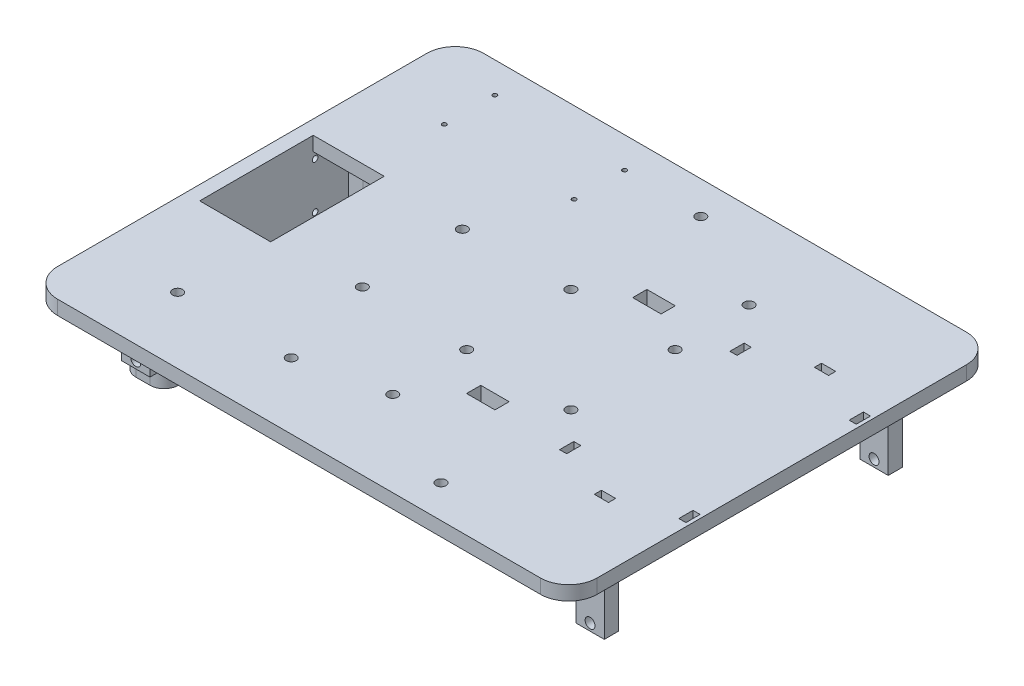
from build123d import *

# Parameters (mm, degrees)
BOSS_EXTRUDE1_DEPTH = 5
SKETCH2_R           = 1.75
SKETCH2_R_2         = 0.75
SKETCH2_W           = 10
SKETCH2_H           = 5
SKETCH2_W_2         = 2.5
SKETCH2_W_3         = 25
SKETCH2_H_2         = 40
SKETCH2_W_4         = 5
SKETCH2_H_3         = 2.5
CUT_EXTRUDE1_DEPTH  = 122.140414396
SKETCH6_W           = 10
SKETCH6_H           = 5
BOSS_EXTRUDE3_DEPTH = 25
SKETCH7_R           = 1.75
CUT_EXTRUDE3_DEPTH  = 158.023087474
FILLET1_R           = 2.5
MIRROR2_START       = -55
MIRROR2_OUTLINE_R   = 1.75
MIRROR2_DEPTH       = 10
MIRROR2_START_2     = 45
MIRROR2_2_OUTLINE_R = 1.75
MIRROR2_2_DEPTH     = 10
MIRROR2_START_3     = -87.5
MIRROR2_3_DEPTH     = 175.5
SKETCH8_W           = 10
SKETCH8_H           = 10
BOSS_EXTRUDE4_DEPTH = 37.5
SKETCH9_W           = 85
SKETCH9_H           = 37.5
BOSS_EXTRUDE8_DEPTH = 5
SKETCH10_R          = 1.75
SKETCH10_R_2        = 1
CUT_EXTRUDE4_DEPTH  = 204.116345969
FILLET2_R           = 5


with BuildPart() as part:
    # Sketch1 → Boss-Extrude1 (new body)
    with BuildSketch(Plane(origin=(0, 0, 0), x_dir=(1, 0, 0), z_dir=(0, 1, 0))):
        with BuildLine():
            Line((-85, -75), (85, -75))
            ThreePointArc((85, -75), (92.071067812, -72.071067812), (95, -65))
            Line((95, -65), (95, 65))
            ThreePointArc((95, 65), (92.071067812, 72.071067812), (85, 75))
            Line((85, 75), (-85, 75))
            ThreePointArc((-85, 75), (-92.071067812, 72.071067812), (-95, 65))
            Line((-95, 65), (-95, -65))
            ThreePointArc((-95, -65), (-92.071067812, -72.071067812), (-85, -75))
        make_face()
    extrude(amount=BOSS_EXTRUDE1_DEPTH)

    # Sketch2 → Cut-Extrude1 (cut, through all)
    with BuildSketch(Plane(origin=(0, 5, 0), x_dir=(1, 0, 0), z_dir=(0, 1, 0))):
        with Locations(Location((-66, -51.75, 0), (0, 0, 270))):
            Circle(SKETCH2_R)
        with Locations(Location((-26, -51.75, 0), (0, 0, 270))):
            Circle(SKETCH2_R)
        with Locations(Location((-35.1, 17.6, 0), (0, 0, 270))):
            Circle(SKETCH2_R)
        with Locations(Location((-35.1, -17.6, 0), (0, 0, 270))):
            Circle(SKETCH2_R)
        with Locations(Location((2.400579028, 18.349420972, 0), (0, 0, 270))):
            Circle(SKETCH2_R)
        with Locations(Location((39.099420972, 18.349420972, 0), (0, 0, 270))):
            Circle(SKETCH2_R)
        with Locations(Location((39.099420972, -18.349420972, 0), (0, 0, 270))):
            Circle(SKETCH2_R)
        with Locations(Location((2.400579028, -18.349420972, 0), (0, 0, 270))):
            Circle(SKETCH2_R)
        with Locations(Location((3.011718317, -45.011311623, 0), (0, 0, 270))):
            Circle(SKETCH2_R)
        with Locations(Location((38.488281683, -63.488688377, 0), (0, 0, 270))):
            Circle(SKETCH2_R)
        with Locations(Location((38.488281683, 45.011311623, 0), (0, 0, 270))):
            Circle(SKETCH2_R)
        with Locations(Location((3.011718317, 63.488688377, 0), (0, 0, 270))):
            Circle(SKETCH2_R)
        with Locations(Location((-70.26, 64.19, 0), (0, 0, 270))):
            Circle(SKETCH2_R_2)
        with Locations(Location((-70.26, 46.41, 0), (0, 0, 270))):
            Circle(SKETCH2_R_2)
        with Locations(Location((-24.54, 64.19, 0), (0, 0, 270))):
            Circle(SKETCH2_R_2)
        with Locations(Location((-24.54, 46.41, 0), (0, 0, 270))):
            Circle(SKETCH2_R_2)
        with Locations((20.75, -29.25)):
            Rectangle(SKETCH2_W, SKETCH2_H)
        with Locations((50.5, 30)):
            Rectangle(SKETCH2_W_2, SKETCH2_H)
        with Locations((50.5, -30)):
            Rectangle(SKETCH2_W_2, SKETCH2_H)
        with Locations((92.5, -30)):
            Rectangle(SKETCH2_W_2, SKETCH2_H)
        with Locations((92.5, 30)):
            Rectangle(SKETCH2_W_2, SKETCH2_H)
        with Locations((-77.5, 0)):
            Rectangle(SKETCH2_W_3, SKETCH2_H_2)
        with Locations((20.75, 29.25)):
            Rectangle(SKETCH2_W, SKETCH2_H)
        with Locations((71.5, -38.75)):
            Rectangle(SKETCH2_W_4, SKETCH2_H_3)
        with Locations((71.5, 38.75)):
            Rectangle(SKETCH2_W_4, SKETCH2_H_3)
    extrude(amount=-CUT_EXTRUDE1_DEPTH, mode=Mode.SUBTRACT)

    # Sketch6 → Boss-Extrude3 (add)
    with BuildSketch(Plane.XZ):
        with Locations((-80, 50)):
            Rectangle(SKETCH6_W, SKETCH6_H)
    extrude(amount=BOSS_EXTRUDE3_DEPTH)

    # Sketch7 → Cut-Extrude3 (cut, through all)
    with BuildSketch(Plane(origin=(0, 0, 47.5), x_dir=(-1, 0, 0), z_dir=(0, 0, -1))):
        with Locations((80, -22.5)):
            Circle(SKETCH7_R)
        with Locations((80, -5)):
            Circle(SKETCH7_R)
    extrude(amount=-CUT_EXTRUDE3_DEPTH, mode=Mode.SUBTRACT)

    # Fillet1
    fillet1_edges = [part.edges().sort_by_distance(p)[0] for p in [
        (-75, 0, 50),
        (-80, 0, 52.5),
        (-85, 0, 50),
        (-80, 0, 47.5),
    ]]
    fillet(fillet1_edges, radius=FILLET1_R)

    # Mirror2: read off the stored shape, not the designer's step
    # Mirror2 outline → Mirror2 (add)
    # profile 1 of 2: a face of its own
    with BuildSketch(Plane.XY.offset(MIRROR2_START)):
        with BuildLine():
            Line((87.5, 0), (72.5, 0))
            ThreePointArc((72.5, 0), (74.267766953, -0.732233047), (75, -2.5))
            Line((75, -2.5), (75, -25))
            Line((75, -25), (85, -25))
            Line((85, -25), (85, -2.5))
            ThreePointArc((85, -2.5), (85.732233047, -0.732233047), (87.5, 0))
        make_face()
        with Locations((80, -22.5)):
            Circle(MIRROR2_OUTLINE_R, mode=Mode.SUBTRACT)
        with Locations((80, -5)):
            Circle(MIRROR2_OUTLINE_R, mode=Mode.SUBTRACT)
    # profile 2 of 2: a face of its own
    with BuildSketch(Plane.XY.offset(MIRROR2_START)):
        with BuildLine():
            Line((-75, -25), (-75, -2.5))
            ThreePointArc((-75, -2.5), (-74.267766953, -0.732233047), (-72.5, 0))
            Line((-72.5, 0), (-87.5, 0))
            ThreePointArc((-87.5, 0), (-85.732233047, -0.732233047), (-85, -2.5))
            Line((-85, -2.5), (-85, -25))
            Line((-85, -25), (-75, -25))
        make_face()
        with Locations((-80, -22.5)):
            Circle(MIRROR2_OUTLINE_R, mode=Mode.SUBTRACT)
        with Locations((-80, -5)):
            Circle(MIRROR2_OUTLINE_R, mode=Mode.SUBTRACT)
    extrude(amount=MIRROR2_DEPTH)

    # Mirror2 2 outline → Mirror2 2 (add)
    with BuildSketch(Plane.XY.offset(MIRROR2_START_2)):
        with BuildLine():
            Line((87.5, 0), (72.5, 0))
            ThreePointArc((72.5, 0), (74.267766953, -0.732233047), (75, -2.5))
            Line((75, -2.5), (75, -25))
            Line((75, -25), (85, -25))
            Line((85, -25), (85, -2.5))
            ThreePointArc((85, -2.5), (85.732233047, -0.732233047), (87.5, 0))
        make_face()
        with Locations((80, -22.5)):
            Circle(MIRROR2_2_OUTLINE_R, mode=Mode.SUBTRACT)
        with Locations((80, -5)):
            Circle(MIRROR2_2_OUTLINE_R, mode=Mode.SUBTRACT)
    extrude(amount=MIRROR2_2_DEPTH)

    # Mirror2 3 outline → Mirror2 3 (cut)
    with BuildSketch(Plane.YZ.offset(MIRROR2_START_3)):
        with BuildLine():
            Line((-25, 55), (-25, 52.5))
            Line((-25, 52.5), (-2.5, 52.5))
            ThreePointArc((-2.5, 52.5), (-0.732233047, 53.232233047), (0, 55))
            Line((0, 55), (-25, 55))
        make_face()
        with BuildLine():
            Line((-2.5, 47.5), (-25, 47.5))
            Line((-25, 47.5), (-25, 45))
            Line((-25, 45), (0, 45))
            ThreePointArc((0, 45), (-0.732233047, 46.767766953), (-2.5, 47.5))
        make_face()
        with BuildLine():
            Line((-25, -47.5), (-2.5, -47.5))
            ThreePointArc((-2.5, -47.5), (-0.732233047, -46.767766953), (0, -45))
            Line((0, -45), (-25, -45))
            Line((-25, -45), (-25, -47.5))
        make_face()
        with BuildLine():
            Line((-2.5, -52.5), (-25, -52.5))
            Line((-25, -52.5), (-25, -55))
            Line((-25, -55), (0, -55))
            ThreePointArc((0, -55), (-0.732233047, -53.232233047), (-2.5, -52.5))
        make_face()
    extrude(amount=MIRROR2_3_DEPTH, mode=Mode.SUBTRACT)

    # Sketch8 → Boss-Extrude4 (add)
    with BuildSketch(Plane.XZ):
        with Locations((-85, 37.5)):
            Rectangle(SKETCH8_W, SKETCH8_H)
        with Locations((-85, -37.5)):
            Rectangle(SKETCH8_W, SKETCH8_H)
    extrude(amount=BOSS_EXTRUDE4_DEPTH)

    # Sketch9 → Boss-Extrude8 (add)
    with BuildSketch(Plane.ZY.offset(90)):
        with Locations((0, -18.75)):
            Rectangle(SKETCH9_W, SKETCH9_H)
    extrude(amount=BOSS_EXTRUDE8_DEPTH)

    # Sketch10 → Cut-Extrude4 (cut, through all)
    with BuildSketch(Plane(origin=(-90, 0, 0), x_dir=(0, 0, -1), z_dir=(1, 0, 0))):
        with Locations((-26.25, -27.5)):
            Circle(SKETCH10_R)
        with Locations((-8.75, -27.5)):
            Circle(SKETCH10_R)
        with Locations((8.75, -27.5)):
            Circle(SKETCH10_R)
        with Locations((26.25, -27.5)):
            Circle(SKETCH10_R)
        with Locations((-20.65, -2.5)):
            Circle(SKETCH10_R_2)
        with Locations((-20.65, -18.8)):
            Circle(SKETCH10_R_2)
        with Locations((20.65, -2.5)):
            Circle(SKETCH10_R_2)
        with Locations((20.65, -18.8)):
            Circle(SKETCH10_R_2)
    extrude(amount=-CUT_EXTRUDE4_DEPTH, mode=Mode.SUBTRACT)

    # Fillet2
    fillet2_edges = [part.edges().sort_by_distance(p)[0] for p in [
        (-80, -18.75, -42.5),
        (-80, -18.75, -32.5),
        (-95, -18.75, -42.5),
        (-95, -18.75, 42.5),
        (-80, -18.75, 42.5),
        (-80, -18.75, 32.5),
    ]]
    fillet(fillet2_edges, radius=FILLET2_R - 0.0001)  # a hair under: the kernel refuses the full size


solid = part.part
